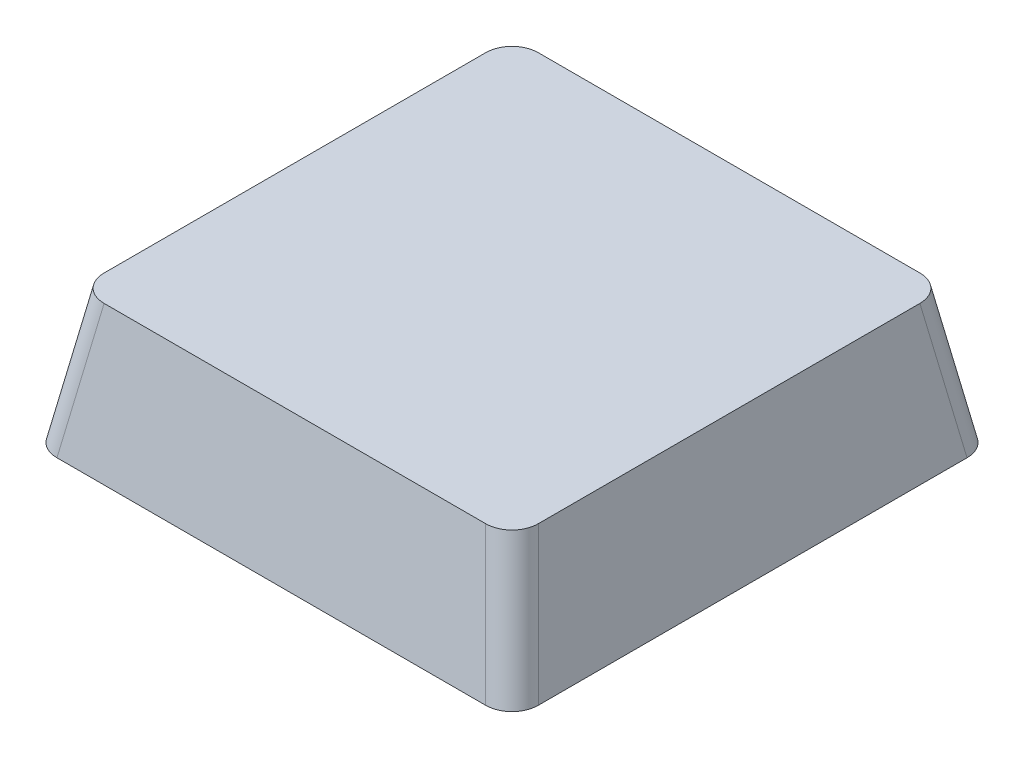
from build123d import *

# Parameters (mm, degrees)
BOSS_EXTRUDE1_DEPTH = 2.8
MIRROR1_START       = -2.8
MIRROR1_DEPTH       = 2.8
CHAMFER2_SIZE       = 0.2
BOSS_EXTRUDE2_DEPTH = 1
SKETCH2_W           = 18
SKETCH2_H           = 18
BOSS_EXTRUDE3_DEPTH = 5
BOSS_EXTRUDE3_TAPER = 10
FILLET1_R           = 1


# Read off the part's stored shape, not the designer's step: Mirror1
with BuildPart() as part:
    # Sketch1 → Boss-Extrude1 (new body)
    with BuildSketch(Plane(origin=(0, 0, 0), x_dir=(1, 0, 0), z_dir=(0, 1, 0))):
        Polygon((-2.85, 0), (-3.45, 0), (-3.45, 0.5), (-3.25, 0.7), (-3.25, 1.2), (-3.45, 1.4), (-3.45, 1.8), (-3.25, 2), (-2.85, 2), align=None)
    extrude(amount=-BOSS_EXTRUDE1_DEPTH)

    # Mirror1 outline → Mirror1 (add)
    with BuildSketch(Plane(origin=(0, 0, 0), x_dir=(1, 0, 0), z_dir=(0, 1, 0)).offset(MIRROR1_START)):
        Polygon((-2.85, 0), (-3.45, 0), (-3.45, -0.5), (-3.25, -0.7), (-3.25, -1.2), (-3.45, -1.4), (-3.45, -1.8), (-3.25, -2), (-2.45, -2), (-2.25, -1.8), (-2.25, -1.4), (-2.45, -1.2), (-2.45, -0.7), (-2.25, -0.5), (-2.25, 0.5), (-2.45, 0.7), (-2.45, 1.2), (-2.25, 1.4), (-2.25, 1.8), (-2.45, 2), (-2.85, 2), align=None)
    extrude(amount=MIRROR1_DEPTH)

    # Chamfer2
    chamfer2_edges = [part.edges().sort_by_distance(p)[0] for p in [
        (-2.85, -2.8, -2),
        (-3.35, -2.8, -1.9),
        (-3.45, -2.8, -1.6),
        (-3.35, -2.8, -1.3),
        (-3.25, -2.8, -0.95),
        (-2.35, -2.8, -0.6),
        (-2.25, -2.8, 0),
        (-2.35, -2.8, 0.6),
        (-2.85, -2.8, 2),
        (-3.35, -2.8, 1.9),
        (-3.45, -2.8, 1.6),
        (-3.35, -2.8, 1.3),
        (-3.25, -2.8, 0.95),
        (-2.35, -2.8, -1.9),
        (-2.25, -2.8, -1.6),
        (-2.35, -2.8, -1.3),
        (-2.45, -2.8, -0.95),
        (-3.35, -2.8, 0.6),
        (-3.35, -2.8, -0.6),
        (-2.45, -2.8, 0.95),
        (-2.35, -2.8, 1.3),
        (-2.25, -2.8, 1.6),
        (-2.35, -2.8, 1.9),
        (-3.45, -2.8, 0),
    ]]
    chamfer(chamfer2_edges, length=CHAMFER2_SIZE)


with BuildPart() as body_2:
    # Mirror5: mirrored copy
    add(part.part.mirror(Plane(origin=(0, 0, 0), x_dir=(0, 0, 1), z_dir=(1, 0, 0))))


with BuildPart() as part_1:
    add(part.part)

    add(body_2.part)  # Boss-Extrude2 merges body 2
    # Sketch1<4> → Boss-Extrude2 (add)
    # profile 1 of 2: a face of its own
    with BuildSketch(Plane(origin=(0, 0, 0), x_dir=(1, 0, 0), z_dir=(0, 1, 0))):
        Polygon((-5, 1.7), (-4.6, 2.1), (4.6, 2.1), (5, 1.7), (5, -1.7), (4.6, -2.1), (-4.6, -2.1), (-5, -1.7), align=None)
        Polygon((-2.85, 2), (-2.85, 0), (-3.45, 0), (-3.45, 0.5), (-3.25, 0.7), (-3.25, 1.2), (-3.45, 1.4), (-3.45, 1.8), (-3.25, 2), align=None, mode=Mode.SUBTRACT)
    # profile 2 of 2: a face of its own
    with BuildSketch(Plane(origin=(0, 0, 0), x_dir=(1, 0, 0), z_dir=(0, 1, 0))):
        Polygon((-2.85, 0), (-3.45, 0), (-3.45, 0.5), (-3.25, 0.7), (-3.25, 1.2), (-3.45, 1.4), (-3.45, 1.8), (-3.25, 2), (-2.85, 2), align=None)
    extrude(amount=BOSS_EXTRUDE2_DEPTH)

    # Sketch2 → Boss-Extrude3 (add)
    with BuildSketch(Plane(origin=(0, 0, 0), x_dir=(1, 0, 0), z_dir=(0, 1, 0))):
        Rectangle(SKETCH2_W, SKETCH2_H)
    extrude(amount=BOSS_EXTRUDE3_DEPTH, taper=BOSS_EXTRUDE3_TAPER)

    # Fillet1
    fillet1_edges = [part_1.edges().sort_by_distance(p)[0] for p in [
        (8.559182548, 2.5, 8.559182548),
        (8.559182548, 2.5, -8.559182548),
        (-8.559182548, 2.5, -8.559182548),
        (-8.559182548, 2.5, 8.559182548),
    ]]
    fillet(fillet1_edges, radius=FILLET1_R)


solid = part_1.part
